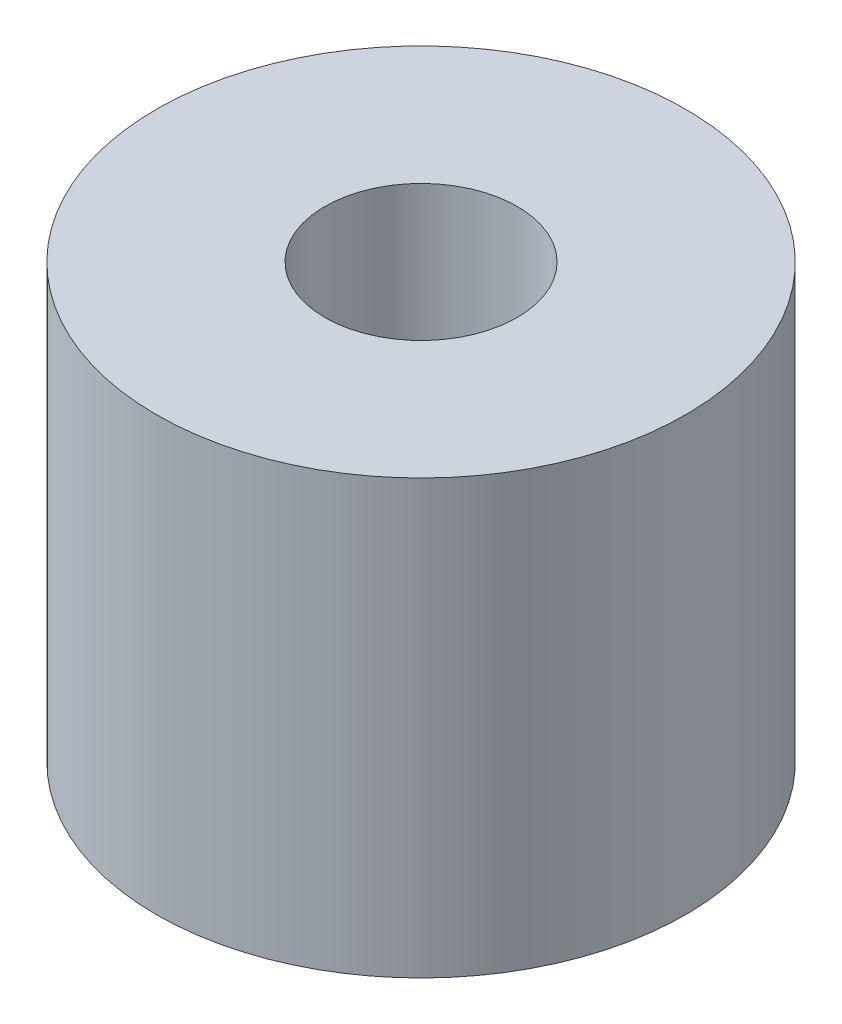
from build123d import *

# Parameters (mm, degrees)
SKETCH1_R               = 11
BOSS_EXTRUDE1_DEPTH     = 18
ADVANCEDHOLE1_OUTLINE_R = 4
ADVANCEDHOLE1_DEPTH     = 18


# Read off the part's stored shape, not the designer's step: AdvancedHole1
with BuildPart() as part:
    # Sketch1 → Boss-Extrude1 (new body)
    with BuildSketch(Plane(origin=(0, 0, 0), x_dir=(1, 0, 0), z_dir=(0, 1, 0))):
        with Locations(Location((-3.016287184, 4.628440679, 0), (0, 0, 270))):
            Circle(SKETCH1_R)
    extrude(amount=BOSS_EXTRUDE1_DEPTH)

    # AdvancedHole1 outline → AdvancedHole1 (cut)
    with BuildSketch(Plane(origin=(0, 0, 0), x_dir=(1, 0, 0), z_dir=(0, 1, 0))):
        with Locations((-3.016287184, 4.628440679)):
            Circle(ADVANCEDHOLE1_OUTLINE_R)
    extrude(amount=ADVANCEDHOLE1_DEPTH, mode=Mode.SUBTRACT)


solid = part.part
